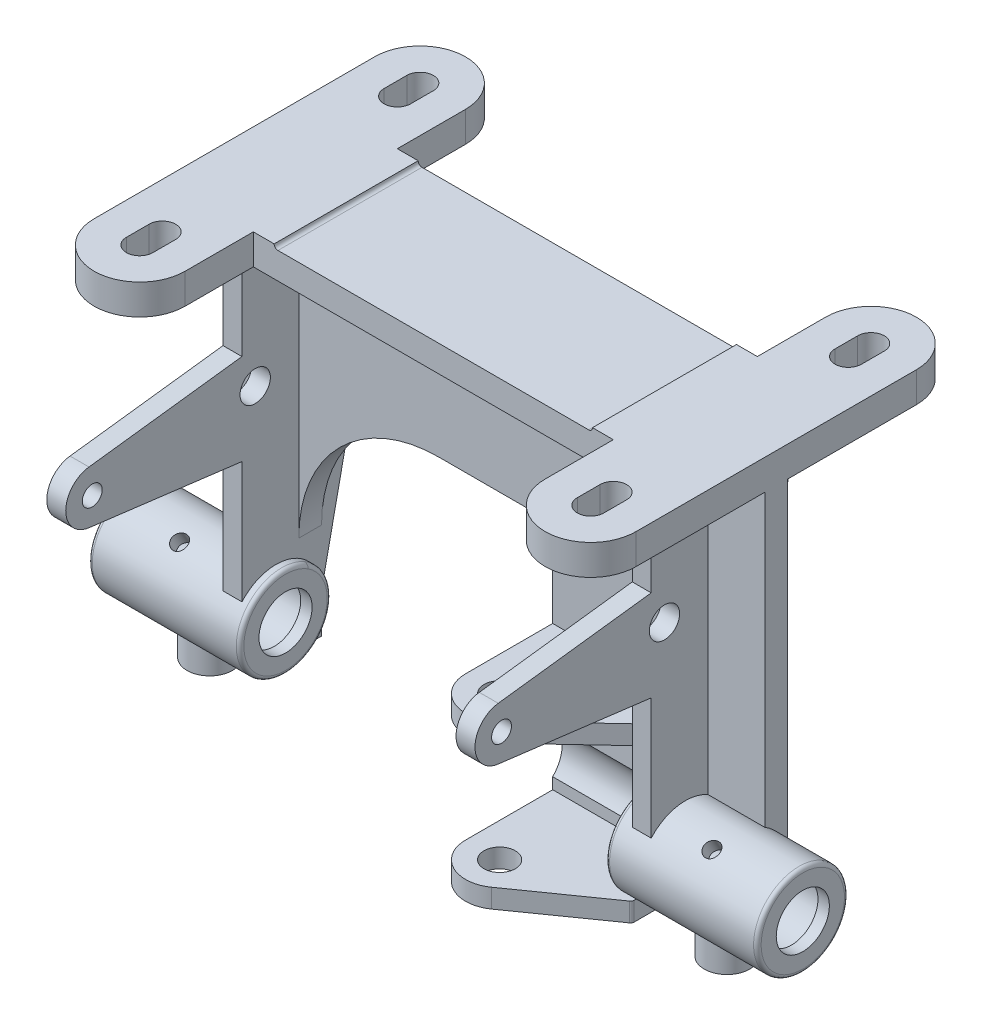
from build123d import *

# Parameters (mm, degrees)
SKETCH1_W                 = 150.8125
SKETCH1_H                 = 60.325
BOSS_EXTRUDE1_DEPTH       = 12.7
BOSS_EXTRUDE2_START       = -7.9375
BOSS_EXTRUDE2_OUTLINE_R   = 4.1671875
BOSS_EXTRUDE2_OUTLINE_R_2 = 6.35
BOSS_EXTRUDE2_DEPTH       = 7.9375
CUT_EXTRUDE1_REACH        = 228.24
CUT_EXTRUDE1_END_RADIUS   = 19.049999411
SKETCH6_R                 = 3.175
BOSS_EXTRUDE3_START       = -227.0125
BOSS_EXTRUDE3_DEPTH       = 227.0125
CUT_EXTRUDE3_START        = -0.000418205
CUT_EXTRUDE3_DEPTH        = 0.000418205
CUT_EXTRUDE3_START_2      = -4.762081795
CUT_EXTRUDE3_2_DEPTH      = 9.524581795
CUT_EXTRUDE3_START_3      = -81.75625
CUT_EXTRUDE3_3_DEPTH      = 106.3625
CUT_EXTRUDE3_4_DEPTH      = 3.96875
SKETCH9_R                 = 14.2875
SKETCH9_R_2               = 6.5484375
BOSS_EXTRUDE4_DEPTH       = 7.9375
SKETCH10_R                = 14.2875
SKETCH10_R_2              = 6.5484375
BOSS_EXTRUDE5_DEPTH       = 7.9375
BOSS_EXTRUDE6_REACH       = 252.253
BOSS_EXTRUDE6_END_RADIUS  = 19.049999411
SKETCH11_R                = 9.525
SKETCH11_R_2              = 4.1671875
SKETCH11_2_R              = 4.1671875
CUT_EXTRUDE4_DEPTH        = 20.6375
CUT_EXTRUDE5_DEPTH        = 251.25289786
CUT_EXTRUDE5_DEPTH_BACK   = 251.25289786
SKETCH12_W                = 133.35
SKETCH12_H                = 1.5875
SKETCH13_W                = 102.39375
SKETCH13_H                = 32.995566524
CUT_EXTRUDE6_DEPTH        = 249.342291656
FILLET1_R                 = 1.5875


with BuildPart() as part:
    # Sketch1 → Boss-Extrude1 (new body)
    # profile 1 of 3: a face of its own
    with BuildSketch(Plane(origin=(0, 0, 0), x_dir=(1, 0, 0), z_dir=(0, 1, 0))):
        Rectangle(SKETCH1_W, SKETCH1_H)
    # profile 2 of 3: a face of its own
    with BuildSketch(Plane(origin=(0, 0, 0), x_dir=(1, 0, 0), z_dir=(0, 1, 0))):
        with BuildLine():
            ThreePointArc((-75.40625, -58.7375), (-94.45625, -77.7875), (-113.50625, -58.7375))
            Line((-113.50625, -58.7375), (-113.50625, 58.7375))
            ThreePointArc((-113.50625, 58.7375), (-94.45625, 77.7875), (-75.40625, 58.7375))
            Line((-75.40625, 58.7375), (-75.40625, -58.7375))
        make_face()
        with BuildLine():
            ThreePointArc((-88.9, -49.2125), (-94.45625, -43.65625), (-100.0125, -49.2125))
            Line((-100.0125, -49.2125), (-100.0125, -58.7375))
            ThreePointArc((-100.0125, -58.7375), (-94.45625, -64.29375), (-88.9, -58.7375))
            Line((-88.9, -58.7375), (-88.9, -49.2125))
        make_face(mode=Mode.SUBTRACT)
        with BuildLine():
            Line((-88.9, 58.7375), (-88.9, 49.2125))
            ThreePointArc((-88.9, 49.2125), (-94.45625, 43.65625), (-100.0125, 49.2125))
            Line((-100.0125, 49.2125), (-100.0125, 58.7375))
            ThreePointArc((-100.0125, 58.7375), (-94.45625, 64.29375), (-88.9, 58.7375))
        make_face(mode=Mode.SUBTRACT)
    # profile 3 of 3: a face of its own
    with BuildSketch(Plane(origin=(0, 0, 0), x_dir=(1, 0, 0), z_dir=(0, 1, 0))):
        with BuildLine():
            Line((75.40625, 58.7375), (75.40625, -58.7375))
            ThreePointArc((75.40625, -58.7375), (94.45625, -77.7875), (113.50625, -58.7375))
            Line((113.50625, -58.7375), (113.50625, 58.7375))
            ThreePointArc((113.50625, 58.7375), (94.45625, 77.7875), (75.40625, 58.7375))
        make_face()
        with BuildLine():
            ThreePointArc((88.9, 49.2125), (94.45625, 43.65625), (100.0125, 49.2125))
            Line((100.0125, 49.2125), (100.0125, 58.7375))
            ThreePointArc((100.0125, 58.7375), (94.45625, 64.29375), (88.9, 58.7375))
            Line((88.9, 58.7375), (88.9, 49.2125))
        make_face(mode=Mode.SUBTRACT)
        with BuildLine():
            Line((88.9, -58.7375), (88.9, -49.2125))
            ThreePointArc((88.9, -49.2125), (94.45625, -43.65625), (100.0125, -49.2125))
            Line((100.0125, -49.2125), (100.0125, -58.7375))
            ThreePointArc((100.0125, -58.7375), (94.45625, -64.29375), (88.9, -58.7375))
        make_face(mode=Mode.SUBTRACT)
    extrude(amount=-BOSS_EXTRUDE1_DEPTH)

    # Boss-Extrude2: read off the stored shape, not the designer's step
    # Boss-Extrude2 outline → Boss-Extrude2 (add)
    with BuildSketch(Plane(origin=(89.69375, 0, 0), x_dir=(0, 0, -1), z_dir=(1, 0, 0)).offset(BOSS_EXTRUDE2_START)):
        with BuildLine():
            ThreePointArc((-92.661744055, -57.236082068), (-102.39375, -68.2625), (-92.661744055, -79.288917932))
            Line((-92.661744055, -79.288917932), (-28.575, -87.3125))
            Line((-28.575, -87.3125), (-28.575, -138.212109381))
            ThreePointArc((-28.575, -138.212109381), (-7.552308185, -132.992856591), (4.7625, -150.812499411))
            Line((4.7625, -150.812499411), (31.75, -22.780561968))
            ThreePointArc((31.75, -22.780561968), (36.176205191, -15.53701711), (44.176928184, -12.7))
            Line((44.176928184, -12.7), (-28.575, -12.7))
            Line((-28.575, -12.7), (-28.575, -49.2125))
            Line((-28.575, -49.2125), (-92.661744055, -57.236082068))
        make_face()
        with Locations((-91.28125, -68.2625)):
            Circle(BOSS_EXTRUDE2_OUTLINE_R, mode=Mode.SUBTRACT)
        with Locations((-23.01875, -62.70625)):
            Circle(BOSS_EXTRUDE2_OUTLINE_R_2, mode=Mode.SUBTRACT)
    boss_extrude2 = extrude(amount=BOSS_EXTRUDE2_DEPTH)

    # Mirror1: Boss-Extrude2 across plane
    add(boss_extrude2.mirror(Plane(origin=(0, 0, 0), x_dir=(0, 0, 1), z_dir=(1, 0, 0))))


with BuildPart() as revolve1_tool:
    # Sketch4 → Revolve1 (revolve)
    with BuildSketch(Plane.XY.offset(14.2875)):
        with BuildLine():
            Line((-141.2875, -139.6873), (-136.525, -139.6873))
            Line((-136.525, -139.6873), (-136.525, -137.31875))
            Line((-136.525, -137.31875), (-82.55, -137.31875))
            Line((-82.55, -137.31875), (-82.55, -139.6873))
            Line((-82.55, -139.6873), (-77.7875, -139.6873))
            Line((-77.7875, -139.6873), (-77.7875, -133.35))
            ThreePointArc((-77.7875, -133.35), (-78.252467985, -132.227467985), (-79.375, -131.7625))
            Line((-79.375, -131.7625), (-139.7, -131.7625))
            ThreePointArc((-139.7, -131.7625), (-140.822532015, -132.227467985), (-141.2875, -133.35))
            Line((-141.2875, -133.35), (-141.2875, -139.6873))
        make_face()
        with BuildLine():
            Line((80.16875, -139.6873), (80.16875, -137.31875))
            Line((80.16875, -137.31875), (134.14375, -137.31875))
            Line((134.14375, -137.31875), (134.14375, -139.6873))
            Line((134.14375, -139.6873), (138.90625, -139.6873))
            Line((138.90625, -139.6873), (138.90625, -133.35))
            ThreePointArc((138.90625, -133.35), (138.441282015, -132.227467985), (137.31875, -131.7625))
            Line((137.31875, -131.7625), (76.99375, -131.7625))
            ThreePointArc((76.99375, -131.7625), (75.871217985, -132.227467985), (75.40625, -133.35))
            Line((75.40625, -133.35), (75.40625, -139.6873))
            Line((75.40625, -139.6873), (80.16875, -139.6873))
        make_face()
    revolve(axis=Axis((-89.69375, -150.812499411, 14.2875), (1, 0, 0)))


with BuildPart() as part_1:
    add(part.part)


with BuildPart() as part_2:
    # Revolve1: joined with revolve1_tool
    add(part_1.part.fuse(revolve1_tool.part, tol=0.00001))

    # Cut-Extrude1: up to this cylinder (the profile starts inside it)
    cut_extrude1_end = Plane(origin=(-1.190625, -150.812499411, 14.2875), z_dir=(-1, 0, 0)) * Cylinder(CUT_EXTRUDE1_END_RADIUS, 718.623748822, mode=Mode.PRIVATE)
    # Sketch6 → Cut-Extrude1 (cut, up to the surface)
    with BuildSketch(Plane(origin=(0, -150.812499411, 14.2875), x_dir=(1, 0, 0), z_dir=(0, 0.8660254037844379, 0.5000000000000012)), mode=Mode.PRIVATE) as cut_extrude1_sk1:
        with Locations(Location((-112.7125, 0, 0), (0, 0, 90))):
            Circle(SKETCH6_R)
    cut_extrude1_tool1 = extrude(cut_extrude1_sk1.sketch, amount=CUT_EXTRUDE1_REACH, mode=Mode.PRIVATE) & cut_extrude1_end
    add(cut_extrude1_tool1.solids().sort_by_distance((-112.7125, -150.812499, 14.2875))[0], mode=Mode.SUBTRACT)
    # Sketch6 → Cut-Extrude1 (cut, up to the surface)
    with BuildSketch(Plane(origin=(0, -150.812499411, 14.2875), x_dir=(1, 0, 0), z_dir=(0, 0.8660254037844379, 0.5000000000000012)), mode=Mode.PRIVATE) as cut_extrude1_sk2:
        with Locations(Location((110.33125, 0, 0), (0, 0, 90))):
            Circle(SKETCH6_R)
    cut_extrude1_tool2 = extrude(cut_extrude1_sk2.sketch, amount=CUT_EXTRUDE1_REACH, mode=Mode.PRIVATE) & cut_extrude1_end
    add(cut_extrude1_tool2.solids().sort_by_distance((110.33125, -150.812499, 14.2875))[0], mode=Mode.SUBTRACT)

    # Boss-Extrude3: read off the stored shape, not the designer's step
    # Boss-Extrude3 outline → Boss-Extrude3 (add)
    with BuildSketch(Plane.ZY.offset(113.50625).offset(BOSS_EXTRUDE3_START)):
        with BuildLine():
            ThreePointArc((4.7625, -160.370514276), (0.793750589, -150.812499411), (4.7625, -141.254484546))
            Line((4.7625, -141.254484546), (4.7625, -12.7))
            Line((4.7625, -12.7), (-4.7625, -12.7))
            Line((-4.7625, -12.7), (-4.7625, -167.310282673))
            Line((-4.7625, -167.310282673), (4.7625, -167.310282673))
            Line((4.7625, -167.310282673), (4.7625, -160.370514276))
        make_face()
    extrude(amount=BOSS_EXTRUDE3_DEPTH)

    # Cut-Extrude3: read off the stored shape, not the designer's step
    # Cut-Extrude3 outline → Cut-Extrude3 (cut)
    with BuildSketch(Plane(origin=(0, 0, -4.7625), x_dir=(-1, 0, 0), z_dir=(0, 0, -1)).offset(CUT_EXTRUDE3_START)):
        with BuildLine():
            Line((81.75625, -167.310282673), (81.75625, -126.999999411))
            ThreePointArc((81.75625, -126.999999411), (64.55243456, -85.466314851), (23.01875, -68.262499411))
            Line((23.01875, -68.262499411), (-23.01875, -68.262499411))
            ThreePointArc((-23.01875, -68.262499411), (-24.141282015, -68.727467396), (-24.60625, -69.849999411))
            Line((-24.60625, -69.849999411), (-24.60625, -167.310282673))
            Line((-24.60625, -167.310282673), (81.75625, -167.310282673))
        make_face()
    extrude(amount=CUT_EXTRUDE3_DEPTH, mode=Mode.SUBTRACT)

    # Cut-Extrude3 2 outline → Cut-Extrude3 2 (cut)
    with BuildSketch(Plane.XY.offset(CUT_EXTRUDE3_START_2)):
        with BuildLine():
            ThreePointArc((-23.01875, -68.262499411), (-64.55243456, -85.466314851), (-81.75625, -126.999999411))
            Line((-81.75625, -126.999999411), (-81.75625, -167.310282673))
            Line((-81.75625, -167.310282673), (24.60625, -167.310282673))
            Line((24.60625, -167.310282673), (24.60625, -69.849999411))
            ThreePointArc((24.60625, -69.849999411), (24.141282015, -68.727467396), (23.01875, -68.262499411))
            Line((23.01875, -68.262499411), (-23.01875, -68.262499411))
        make_face()
    extrude(amount=CUT_EXTRUDE3_2_DEPTH, mode=Mode.SUBTRACT)

    # Cut-Extrude3 3 outline → Cut-Extrude3 3 (add)
    with BuildSketch(Plane.YZ.offset(CUT_EXTRUDE3_START_3)):
        with BuildLine():
            Line((-160.370514276, 4.7625), (-167.310282673, 4.7625))
            ThreePointArc((-167.310282673, 4.7625), (-150.812499388, -4.762499411), (-134.314716126, 4.762500039))
            Line((-134.314716126, 4.762500039), (-141.254484546, 4.7625))
            ThreePointArc((-141.254484546, 4.7625), (-150.812499411, 0.793750589), (-160.370514276, 4.7625))
        make_face()
    extrude(amount=CUT_EXTRUDE3_3_DEPTH)

    # Cut-Extrude3 4 outline → Cut-Extrude3 4 (add)
    with BuildSketch(Plane.YZ.offset(CUT_EXTRUDE3_START_3)):
        with BuildLine():
            Line((-156.560928495, 4.7625), (-160.370514276, 4.7625))
            ThreePointArc((-160.370514276, 4.7625), (-150.812499411, 0.793750589), (-141.254484546, 4.7625))
            Line((-141.254484546, 4.7625), (-145.064070327, 4.7625))
            ThreePointArc((-145.064070327, 4.7625), (-150.812499411, 3.162300589), (-156.560928495, 4.7625))
        make_face()
    extrude(amount=CUT_EXTRUDE3_4_DEPTH)

    # Sketch9 → Boss-Extrude4 (add)
    # profile 1 of 2: a face of its own
    with BuildSketch(Plane(origin=(0, -173.0375, 0), x_dir=(1, 0, 0), z_dir=(0, 1, 0))):
        with Locations((38.89375, -41.275)):
            Circle(SKETCH9_R)
        with Locations(Location((38.89375, -41.275, 0), (0, 0, 270))):
            Circle(SKETCH9_R_2, mode=Mode.SUBTRACT)
    # profile 2 of 2: a face of its own
    with BuildSketch(Plane(origin=(0, -173.0375, 0), x_dir=(1, 0, 0), z_dir=(0, 1, 0))):
        with BuildLine():
            ThreePointArc((53.18125, -41.275), (51.575143591, -47.8564066), (47.11792012, -52.958136655))
            Line((47.11792012, -52.958136655), (81.08254668, -29.049243423))
            ThreePointArc((81.08254668, -29.049243423), (81.577793732, -28.482384528), (81.75625, -27.751117128))
            Line((81.75625, -27.751117128), (81.75625, 3.175))
            ThreePointArc((81.75625, 3.175), (81.291282015, 4.297532015), (80.16875, 4.7625))
            Line((80.16875, 4.7625), (24.60625, 4.7625))
            Line((24.60625, 4.7625), (24.60625, -41.275))
            ThreePointArc((24.60625, -41.275), (38.89375, -26.9875), (53.18125, -41.275))
        make_face()
    extrude(amount=BOSS_EXTRUDE4_DEPTH)

    # Sketch10 → Boss-Extrude5 (add)
    # profile 1 of 2: a face of its own
    with BuildSketch(Plane(origin=(0, -112.7125, 0), x_dir=(1, 0, 0), z_dir=(0, 1, 0))):
        with BuildLine():
            Line((24.60625, 4.7625), (24.60625, -41.275))
            ThreePointArc((24.60625, -41.275), (38.89375, -26.9875), (53.18125, -41.275))
            ThreePointArc((53.18125, -41.275), (52.005555729, -46.950667958), (48.671964713, -51.692253634))
            Line((48.671964713, -51.692253634), (81.75625, -20.6375))
            Line((81.75625, -20.6375), (81.75625, 4.7625))
            Line((81.75625, 4.7625), (24.60625, 4.7625))
        make_face()
    # profile 2 of 2: a face of its own
    with BuildSketch(Plane(origin=(0, -112.7125, 0), x_dir=(1, 0, 0), z_dir=(0, 1, 0))):
        with Locations((38.89375, -41.275)):
            Circle(SKETCH10_R)
        with Locations(Location((38.89375, -41.275, 0), (0, 0, 270))):
            Circle(SKETCH10_R_2, mode=Mode.SUBTRACT)
    extrude(amount=BOSS_EXTRUDE5_DEPTH)

    # Boss-Extrude6: up to this cylinder (the profile starts outside it)
    boss_extrude6_end = Plane(origin=(-1.190625, -150.812499411, 14.2875), z_dir=(-1, 0, 0)) * Cylinder(BOSS_EXTRUDE6_END_RADIUS, 760.299748822, mode=Mode.PRIVATE)
    # Sketch11 → Boss-Extrude6 (add, up to the surface)
    with BuildSketch(Plane(origin=(0, -179.3875, 0), x_dir=(-1, 0, 0), z_dir=(0, -1, 0)), mode=Mode.PRIVATE) as boss_extrude6_sk1:
        with Locations(Location((-107.15625, -14.2875, 0), (0, 0, 90))):
            Circle(SKETCH11_R)
        with Locations(Location((-107.15625, -14.2875, 0), (0, 0, 90))):
            Circle(SKETCH11_R_2, mode=Mode.SUBTRACT)
    boss_extrude6_tool1 = extrude(boss_extrude6_sk1.sketch, amount=-BOSS_EXTRUDE6_REACH, mode=Mode.PRIVATE) - boss_extrude6_end
    add(boss_extrude6_tool1.solids().sort_by_distance((107.15625, -179.3875, 23.543092))[0])
    # Sketch11 → Boss-Extrude6 (add, up to the surface)
    with BuildSketch(Plane(origin=(0, -179.3875, 0), x_dir=(-1, 0, 0), z_dir=(0, -1, 0)), mode=Mode.PRIVATE) as boss_extrude6_sk2:
        with Locations(Location((109.5375, -14.2875, 0), (0, 0, 90))):
            Circle(SKETCH11_R)
        with Locations(Location((109.5375, -14.2875, 0), (0, 0, 90))):
            Circle(SKETCH11_R_2, mode=Mode.SUBTRACT)
    boss_extrude6_tool2 = extrude(boss_extrude6_sk2.sketch, amount=-BOSS_EXTRUDE6_REACH, mode=Mode.PRIVATE) - boss_extrude6_end
    add(boss_extrude6_tool2.solids().sort_by_distance((-109.5375, -179.3875, 23.543092))[0])

    # Sketch11<2> → Cut-Extrude4 (cut)
    with BuildSketch(Plane(origin=(0, -179.3875, 0), x_dir=(-1, 0, 0), z_dir=(0, -1, 0))):
        with Locations(Location((-107.15625, -14.2875, 0), (0, 0, 90))):
            Circle(SKETCH11_2_R)
        with Locations(Location((109.5375, -14.2875, 0), (0, 0, 90))):
            Circle(SKETCH11_2_R)
    extrude(amount=-CUT_EXTRUDE4_DEPTH, mode=Mode.SUBTRACT)

    # Sketch12 → Cut-Extrude5 (cut, two sides: drawn at the far end of the back side and taken through both)
    with BuildSketch(Plane.XY.offset(-CUT_EXTRUDE5_DEPTH_BACK)):
        with Locations((0, -0.79375)):
            Rectangle(SKETCH12_W, SKETCH12_H)
    extrude(amount=CUT_EXTRUDE5_DEPTH + CUT_EXTRUDE5_DEPTH_BACK, mode=Mode.SUBTRACT)

    # Sketch13 → Cut-Extrude6 (cut, through all)
    with BuildSketch(Plane.XY.offset(4.7625)):
        with Locations((-26.590625, -150.812499411)):
            Rectangle(SKETCH13_W, SKETCH13_H)
    extrude(amount=-CUT_EXTRUDE6_DEPTH, mode=Mode.SUBTRACT)

    # Fillet1
    fillet1_edges = [part_2.edges().sort_by_distance(p)[0] for p in [
        (-66.675, -1.5875, 0),
        (66.675, -1.5875, 0),
        (-77.7875, -150.812499388, -4.762499411),
    ]]
    fillet(fillet1_edges, radius=FILLET1_R - 0.0001)  # a hair under: the kernel refuses the full size


solid = part_2.part
